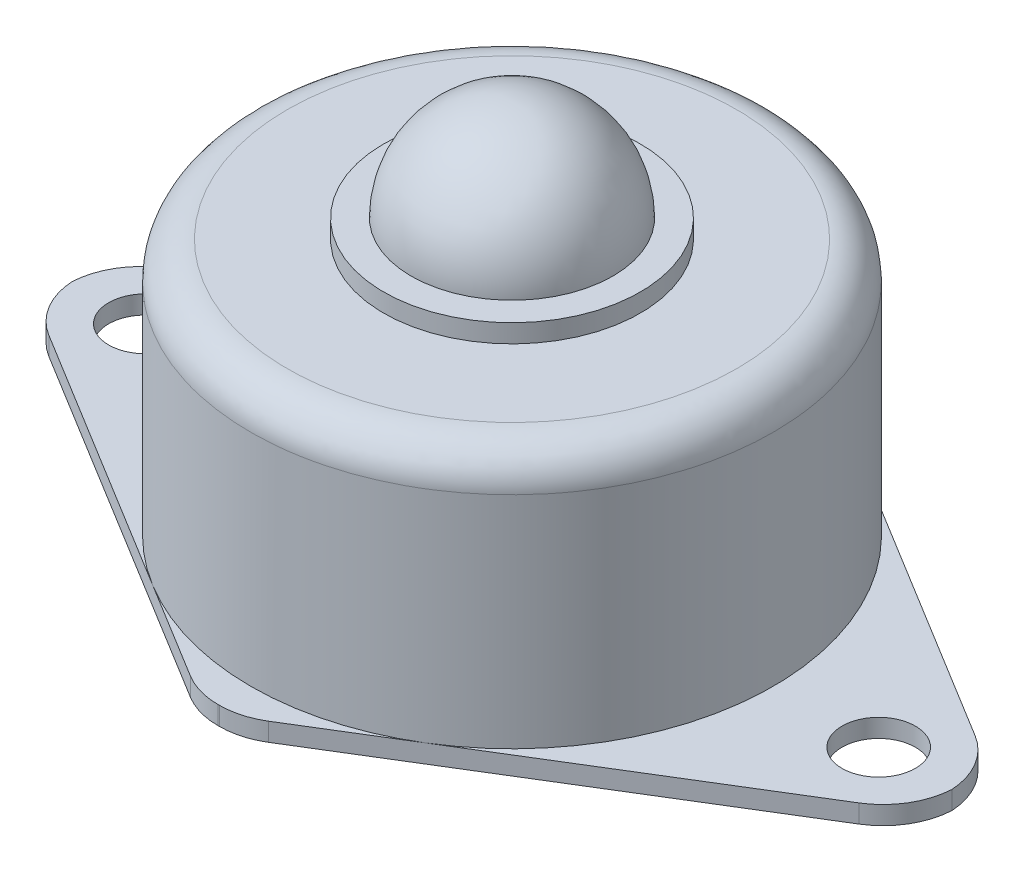
from build123d import *

# Parameters (mm, degrees)
FILLET_1_R      = 2
SKETCH_2_R      = 2
EXTRUDE_1_DEPTH = 1
FILLET_2_R      = 4


with BuildPart() as part:
    # 스케치1 → 회전1 (revolve)
    with BuildSketch(Plane.XY):
        with BuildLine():
            Line((-5.5, 15), (-7, 15))
            Line((-7, 15), (-7, 14))
            Line((-7, 14), (-14.25, 14))
            Line((-14.25, 14), (-14.25, 0))
            Line((-14.25, 0), (0, 0))
            Line((0, 0), (0, 20.5))
            ThreePointArc((0, 20.5), (-3.889087297, 18.889087297), (-5.5, 15))
        make_face()
    revolve(axis=Axis((0, 20.5, 0), (0, -1, 0)))

    # 필렛1
    fillet_1_edges = [part.edges().sort_by_distance(p)[0] for p in [
        (14.25, 14, 0),
    ]]
    fillet(fillet_1_edges, radius=FILLET_1_R)

    # 스케치2 → 보스-돌출1 (add)
    with BuildSketch(Plane(origin=(0, 0, 0), x_dir=(1, 0, 0), z_dir=(0, 1, 0))):
        Polygon((-1.166627447, 16), (-24, 2), (-24, -2), (-1.166627447, -16), (1.166627447, -16), (24, -2), (24, 2), (1.166627447, 16), align=None)
        with Locations(Location((-20, 0, 0), (0, 0, 270))):
            Circle(SKETCH_2_R, mode=Mode.SUBTRACT)
        with Locations(Location((20, 0, 0), (0, 0, 270))):
            Circle(SKETCH_2_R, mode=Mode.SUBTRACT)
    extrude(amount=-EXTRUDE_1_DEPTH)

    # 필렛2
    # the kernel refuses this fillet: 4 mm, written as the material it takes off along each edge
    with BuildSketch(Plane(origin=(24, 5.598660997, -2), x_dir=(-0.8525122061525764, 0, -0.5227073161539516), z_dir=(0, -1, 0)), Plane(origin=(24, 5.598660997, 2), x_dir=(0, 0, -1), z_dir=(0, -1, 0)), Plane(origin=(-24, 5.598660997, 2), x_dir=(0.852512206152576, 0, 0.5227073161539524), z_dir=(0, -1, 0)), Plane(origin=(-24, 5.598660997, -2), x_dir=(0, 0, 1), z_dir=(0, -1, 0))) as fillet_2_piece_1:
        with BuildLine():
            CenterArc((FILLET_2_R * 0.559866099748, -FILLET_2_R), FILLET_2_R, 90, 58.485971252)
            Line((-FILLET_2_R * 0.292646106405, -FILLET_2_R * 0.477292683846), (0, 0))
            Line((0, 0), (FILLET_2_R * 0.559866099748, 0))
        make_face()
    extrude(amount=12.197321995, mode=Mode.SUBTRACT)
    with BuildSketch(Plane(origin=(1.166627447, 2.821613344, 16), x_dir=(0.8525122061525761, 0, -0.5227073161539519), z_dir=(0, -1, 0)), Plane(origin=(1.166627447, 2.821613344, -16), x_dir=(-1, 0, 0), z_dir=(0, -1, 0)), Plane(origin=(-1.166627447, 2.821613344, -16), x_dir=(-0.8525122061525764, 0, 0.5227073161539515), z_dir=(0, -1, 0))) as fillet_2_piece_2:
        with BuildLine():
            CenterArc((FILLET_2_R * 0.28216133444, -FILLET_2_R), FILLET_2_R, 90, 31.514028748)
            Line((-FILLET_2_R * 0.240545981714, -FILLET_2_R * 0.147487793847), (0, 0))
            Line((0, 0), (FILLET_2_R * 0.28216133444, 0))
        make_face()
    extrude(amount=6.643226689, mode=Mode.SUBTRACT)
    with BuildSketch(Plane(origin=(-1.166627447, 2.821613344, 16), x_dir=(-0.8525122061525756, 0, -0.5227073161539529), z_dir=(0, -1, 0))) as fillet_2_piece_3:
        with BuildLine():
            CenterArc((FILLET_2_R * 0.28216133444, FILLET_2_R), FILLET_2_R, 238.485971252, 31.514028748)
            Line((-FILLET_2_R * 0.240545981714, FILLET_2_R * 0.147487793847), (0, 0))
            Line((0, 0), (FILLET_2_R * 0.28216133444, 0))
        make_face()
    extrude(amount=6.643226689, mode=Mode.SUBTRACT)


solid = part.part
